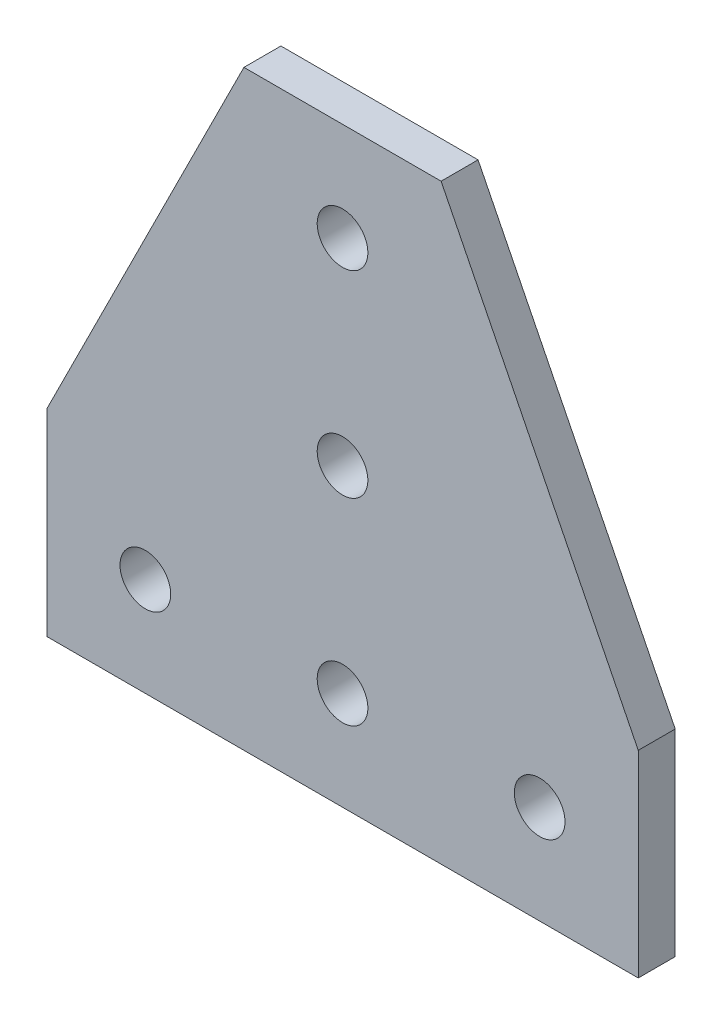
from build123d import *

# Parameters (mm, degrees)
SKETCH1_R           = 3.2639
BOSS_EXTRUDE1_DEPTH = 2.38125


with BuildPart() as part:
    # Sketch1 → Boss-Extrude1 (new, symmetric)
    with BuildSketch(Plane.XY):
        Polygon((0, 0), (0, 25.4), (25.4, 76.2), (50.8, 76.2), (76.2, 25.4), (76.2, 0), align=None)
        with Locations((12.7, 12.7)):
            Circle(SKETCH1_R, mode=Mode.SUBTRACT)
        with Locations((38.1, 12.7)):
            Circle(SKETCH1_R, mode=Mode.SUBTRACT)
        with Locations((63.5, 12.7)):
            Circle(SKETCH1_R, mode=Mode.SUBTRACT)
        with Locations((38.1, 38.1)):
            Circle(SKETCH1_R, mode=Mode.SUBTRACT)
        with Locations((38.1, 63.5)):
            Circle(SKETCH1_R, mode=Mode.SUBTRACT)
    extrude(amount=BOSS_EXTRUDE1_DEPTH, both=True)


solid = part.part
